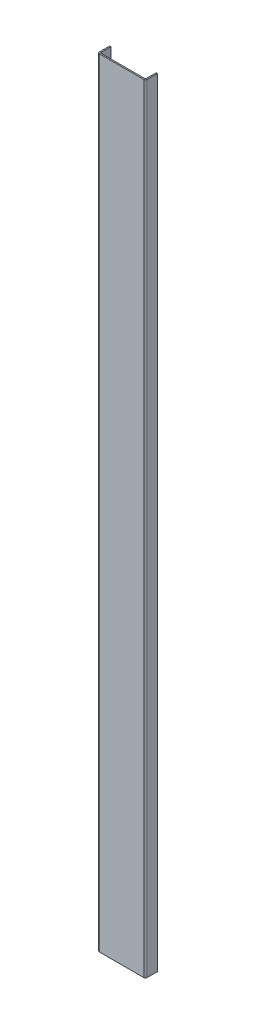
from build123d import *

# Parameters (mm, degrees)
BASE_FLANGE1_DEPTH = 921.5


# Sheet-metal steps are written as plain solids
with BuildPart() as part:
    # Sketch1 → Base-Flange1 (new body)
    with BuildSketch(Plane(origin=(0, 0, 0), x_dir=(1, 0, 0), z_dir=(0, 1, 0))):
        with BuildLine():
            Line((28.25, 14), (28.25, 2))
            ThreePointArc((28.25, 2), (27.664213562, 0.585786438), (26.25, 0))
            Line((26.25, 0), (-26.25, 0))
            ThreePointArc((-26.25, 0), (-27.664213562, 0.585786438), (-28.25, 2))
            Line((-28.25, 2), (-28.25, 14))
            Line((-28.25, 14), (-26.75, 14))
            Line((-26.75, 14), (-26.75, 2))
            ThreePointArc((-26.75, 2), (-26.603553391, 1.646446609), (-26.25, 1.5))
            Line((-26.25, 1.5), (26.25, 1.5))
            ThreePointArc((26.25, 1.5), (26.603553391, 1.646446609), (26.75, 2))
            Line((26.75, 2), (26.75, 14))
            Line((26.75, 14), (28.25, 14))
        make_face()
    extrude(amount=BASE_FLANGE1_DEPTH)


solid = part.part
